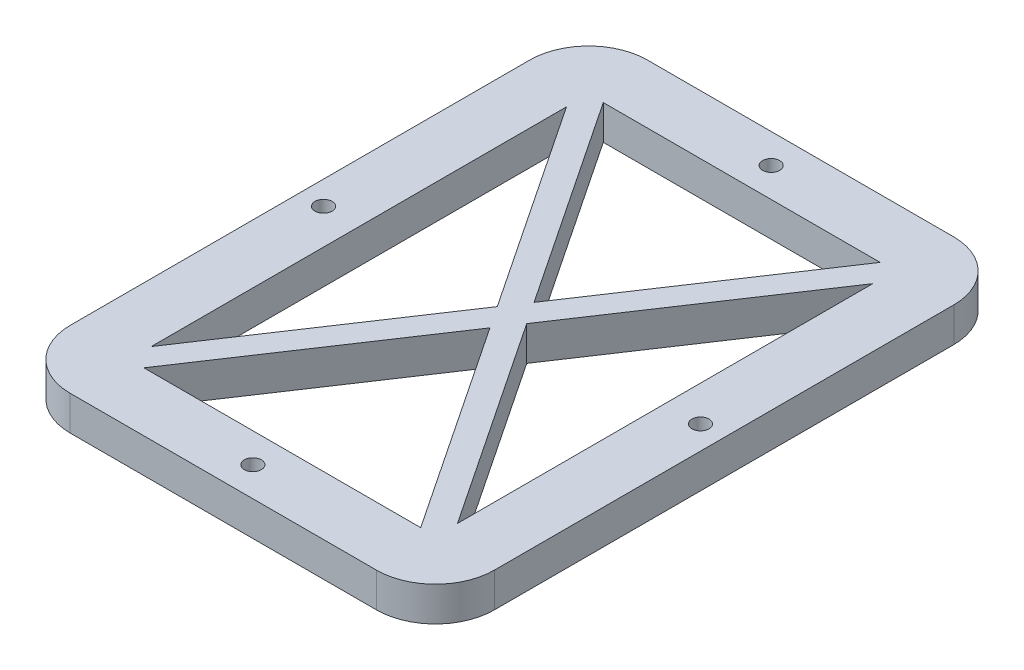
from build123d import *

# Parameters (mm, degrees)
SKETCH1_R           = 1.45
BOSS_EXTRUDE1_DEPTH = 5.85


with BuildPart() as part:
    # Sketch1 → Boss-Extrude1 (new body)
    with BuildSketch(Plane(origin=(0, 0, 0), x_dir=(1, 0, 0), z_dir=(0, 1, 0))):
        with BuildLine():
            ThreePointArc((-26, 49), (-33.071067812, 46.071067812), (-36, 39))
            Line((-36, 39), (-36, -39))
            ThreePointArc((-36, -39), (-33.071067812, -46.071067812), (-26, -49))
            Line((-26, -49), (26, -49))
            ThreePointArc((26, -49), (33.071067812, -46.071067812), (36, -39))
            Line((36, -39), (36, 39))
            ThreePointArc((36, 39), (33.071067812, 46.071067812), (26, 49))
            Line((26, 49), (-26, 49))
        make_face()
        with Locations((0, -44)):
            Circle(SKETCH1_R, mode=Mode.SUBTRACT)
        with Locations((-32, 0)):
            Circle(SKETCH1_R, mode=Mode.SUBTRACT)
        with Locations((32, 0)):
            Circle(SKETCH1_R, mode=Mode.SUBTRACT)
        Polygon((23.5, -39), (-23.5, -39), (0, -3.75), align=None, mode=Mode.SUBTRACT)
        Polygon((26, 35.25), (26, -35.25), (2.5, 0), align=None, mode=Mode.SUBTRACT)
        Polygon((-23.5, 39), (23.5, 39), (0, 3.75), align=None, mode=Mode.SUBTRACT)
        Polygon((-26, -35.25), (-26, 35.25), (-2.5, 0), align=None, mode=Mode.SUBTRACT)
        with Locations((0, 44)):
            Circle(SKETCH1_R, mode=Mode.SUBTRACT)
    extrude(amount=BOSS_EXTRUDE1_DEPTH)


solid = part.part
